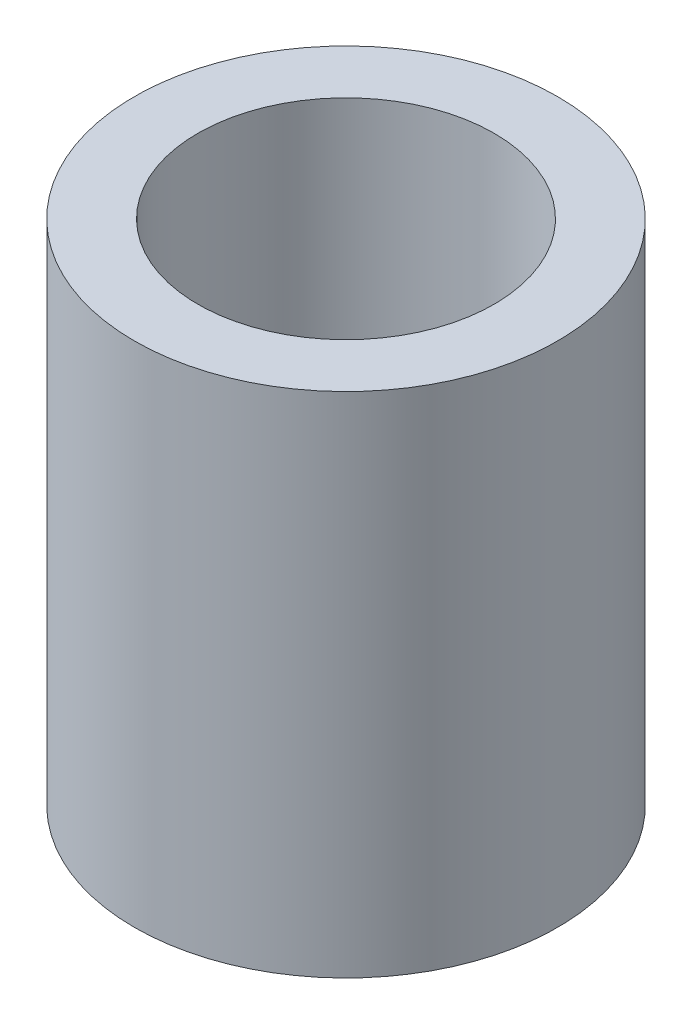
from build123d import *

# Parameters (mm, degrees)
SKETCH1_R           = 7.9375
SKETCH1_R_2         = 5.55625
BOSS_EXTRUDE1_DEPTH = 19.05


with BuildPart() as part:
    # Sketch1 → Boss-Extrude1 (new body)
    with BuildSketch(Plane(origin=(0, 0, 0), x_dir=(1, 0, 0), z_dir=(0, 1, 0))):
        Circle(SKETCH1_R)
        Circle(SKETCH1_R_2, mode=Mode.SUBTRACT)
    extrude(amount=BOSS_EXTRUDE1_DEPTH)


solid = part.part
